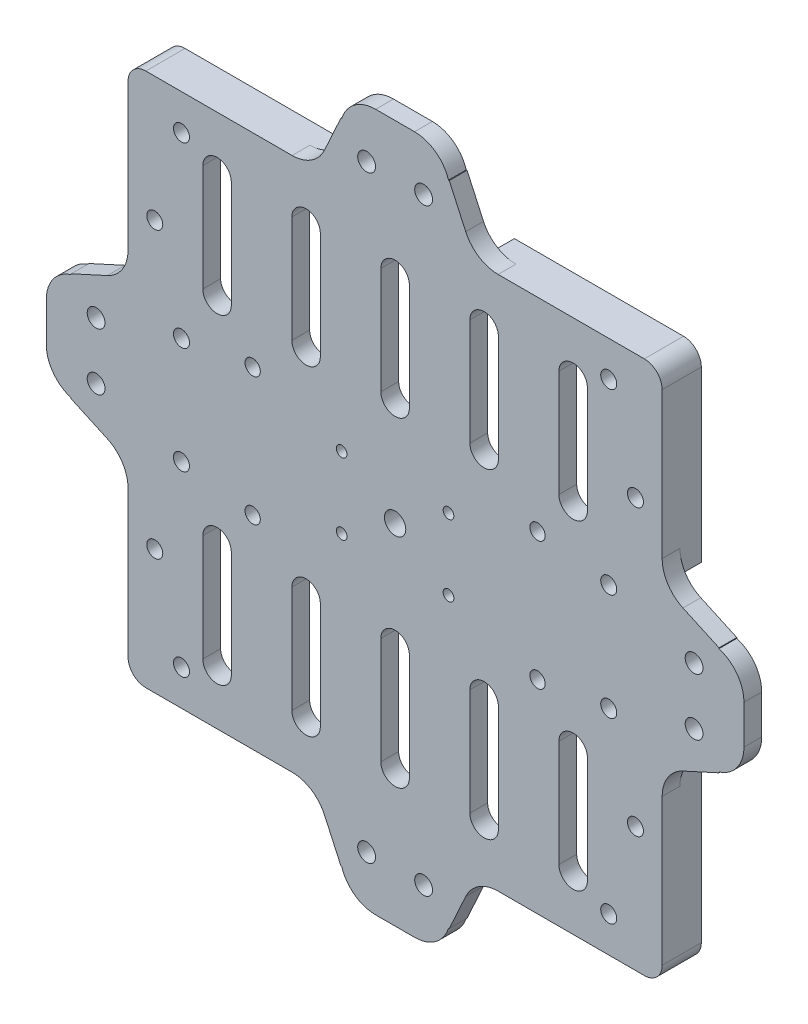
from build123d import *

# Parameters (mm, degrees)
SKETCH1_R           = 3
SKETCH1_R_2         = 2.5
SKETCH1_W           = 3
SKETCH1_H           = 12
SKETCH1_W_2         = 21
SKETCH1_H_2         = 3
SKETCH1_H_3         = 8
SKETCH1_W_3         = 12
SKETCH1_H_4         = 21
SKETCH1_W_4         = 8
BOSS_EXTRUDE1_DEPTH = 2.5
BOSS_EXTRUDE3_START = -8.5
BOSS_EXTRUDE3_DEPTH = 6
SKETCH6_R           = 2.15
SKETCH6_R_2         = 1.5
CUT_EXTRUDE3_DEPTH  = 5
BOSS_EXTRUDE4_START = -2.5
SKETCH7_W           = 7
SKETCH7_H           = 30
SKETCH7_W_2         = 30
SKETCH7_H_2         = 7
BOSS_EXTRUDE4_DEPTH = 5
FILLET1_R           = 10
FILLET3_R           = 5
SKETCH9_R           = 2.25
CUT_EXTRUDE4_DEPTH  = 5


with BuildPart() as part:
    # Sketch1 → Boss-Extrude1 (new, symmetric)
    # profile 1 of 31: a face of its own
    with BuildSketch(Plane.XY):
        Polygon((-72, -72), (-22.500000003, -72), (-10.500000004, -72), (-10.500000004, -64), (10.499999996, -64), (10.499999996, -72), (22.499999996, -72), (72, -72), (72, -22.500000003), (72, -10.500000004), (64, -10.500000004), (64, 10.499999996), (72, 10.499999996), (72, 22.499999996), (72, 72), (22.500000003, 72), (10.500000004, 72), (10.500000004, 64), (-10.499999996, 64), (-10.499999996, 72), (-22.499999996, 72), (-45, 72), (-72, 72), (-72, 45), (-72, 22.500000003), (-72, 10.500000004), (-64, 10.500000004), (-64, -10.499999996), (-72, -10.499999996), (-72, -22.499999996), align=None)
        Circle(SKETCH1_R, mode=Mode.SUBTRACT)
    # profile 2 of 31: a face of its own
    with BuildSketch(Plane.XY):
        Polygon((-90, 15.649247909), (-90, -15.649247896), (-74.99999999, -22.499999996), (-75, -10.499999996), (-75, 10.500000004), (-75, 22.500000003), align=None)
        with Locations((-83.969786151, -7.999999996)):
            Circle(SKETCH1_R_2, mode=Mode.SUBTRACT)
        with Locations((-83.969786151, 8.000000004)):
            Circle(SKETCH1_R_2, mode=Mode.SUBTRACT)
    # profile 3 of 31: a face of its own
    with BuildSketch(Plane.XY):
        Polygon((-72, 22.500000003), (-74.99999999, 22.500000003), (-75, 10.500000004), (-72, 10.500000004), align=None)
    # profile 4 of 31: a face of its own
    with BuildSketch(Plane.XY):
        Polygon((-75, 26.557364843), (-75, 22.500000003), (-72, 22.500000003), (-72, 45), (-75, 45), align=None)
    # profile 5 of 31: a face of its own
    with BuildSketch(Plane.XY):
        with Locations((-73.5, -16.499999996)):
            Rectangle(SKETCH1_W, SKETCH1_H)
    # profile 6 of 31: a face of its own
    with BuildSketch(Plane.XY):
        Polygon((-75, -75), (-22.500000003, -75), (-22.500000003, -72), (-72, -72), (-72, -22.499999996), (-74.99999999, -22.499999996), (-75, -24.91224327), align=None)
    # profile 7 of 31: a face of its own
    with BuildSketch(Plane.XY):
        Polygon((-22.500000003, -74.99999999), (-15.649247909, -90), (15.649247896, -90), (22.499999996, -74.99999999), (10.499999996, -75), (-10.500000004, -75), align=None)
        with Locations((-8.000000004, -83.969786151)):
            Circle(SKETCH1_R_2, mode=Mode.SUBTRACT)
        with Locations((7.999999996, -83.969786151)):
            Circle(SKETCH1_R_2, mode=Mode.SUBTRACT)
    # profile 8 of 31: a face of its own
    with BuildSketch(Plane.XY):
        Polygon((-22.500000003, -72), (-22.500000003, -74.99999999), (-10.500000004, -75), (-10.500000004, -72), align=None)
    # profile 9 of 31: a face of its own
    with BuildSketch(Plane.XY):
        with Locations((-4e-09, -73.5)):
            Rectangle(SKETCH1_W_2, SKETCH1_H_2)
    # profile 10 of 31: a face of its own
    with BuildSketch(Plane.XY):
        with Locations((-4e-09, -68)):
            Rectangle(SKETCH1_W_2, SKETCH1_H_3)
    # profile 11 of 31: a face of its own
    with BuildSketch(Plane.XY):
        with Locations((16.499999996, -73.5)):
            Rectangle(SKETCH1_W_3, SKETCH1_H_2)
    # profile 12 of 31: a face of its own
    with BuildSketch(Plane.XY):
        Polygon((22.499999996, -72), (22.499999996, -74.99999999), (75, -75), (75, -22.500000003), (72, -22.500000003), (72, -72), align=None)
    # profile 13 of 31: a face of its own
    with BuildSketch(Plane.XY):
        Polygon((15.649247896, -90), (-15.649247909, -90), (-15.206330276, -90.969786151), (15.206330267, -90.969786141), align=None)
    # profile 14 of 31: a face of its own
    with BuildSketch(Plane.XY):
        Polygon((72, -22.500000003), (74.99999999, -22.500000003), (75, -10.500000004), (72, -10.500000004), align=None)
    # profile 15 of 31: a face of its own
    with BuildSketch(Plane.XY):
        Polygon((74.99999999, -22.500000003), (90, -15.649247909), (90, 15.649247896), (74.99999999, 22.499999996), (75, 10.499999996), (75, -10.500000004), align=None)
        with Locations((83.969786151, -8.000000004)):
            Circle(SKETCH1_R_2, mode=Mode.SUBTRACT)
        with Locations((83.969786151, 7.999999996)):
            Circle(SKETCH1_R_2, mode=Mode.SUBTRACT)
    # profile 16 of 31: a face of its own
    with BuildSketch(Plane.XY):
        Polygon((90, 15.649247896), (90, -15.649247909), (90.969786151, -15.206330276), (90.969786141, 15.206330267), align=None)
    # profile 17 of 31: a face of its own
    with BuildSketch(Plane.XY):
        with Locations((73.5, -4e-09)):
            Rectangle(SKETCH1_W, SKETCH1_H_4)
    # profile 18 of 31: a face of its own
    with BuildSketch(Plane.XY):
        with Locations((68, -4e-09)):
            Rectangle(SKETCH1_W_4, SKETCH1_H_4)
    # profile 19 of 31: a face of its own
    with BuildSketch(Plane.XY):
        with Locations((73.5, 16.499999996)):
            Rectangle(SKETCH1_W, SKETCH1_H)
    # profile 20 of 31: a face of its own
    with BuildSketch(Plane.XY):
        Polygon((72, 22.499999996), (74.99999999, 22.499999996), (75, 75), (22.500000003, 75), (22.500000003, 72), (72, 72), align=None)
    # profile 21 of 31: a face of its own
    with BuildSketch(Plane.XY):
        Polygon((22.500000003, 72), (22.500000003, 74.99999999), (10.500000004, 75), (10.500000004, 72), align=None)
    # profile 22 of 31: a face of its own
    with BuildSketch(Plane.XY):
        Polygon((15.649247909, 90), (-15.649247896, 90), (-22.499999996, 74.99999999), (-10.499999996, 75), (10.500000004, 75), (22.500000003, 75), align=None)
        with Locations((-7.999999996, 83.969786151)):
            Circle(SKETCH1_R_2, mode=Mode.SUBTRACT)
        with Locations((8.000000004, 83.969786151)):
            Circle(SKETCH1_R_2, mode=Mode.SUBTRACT)
    # profile 23 of 31: a face of its own
    with BuildSketch(Plane.XY):
        with Locations((-16.499999996, 73.5)):
            Rectangle(SKETCH1_W_3, SKETCH1_H_2)
    # profile 24 of 31: a face of its own
    with BuildSketch(Plane.XY):
        with Locations((4e-09, 73.5)):
            Rectangle(SKETCH1_W_2, SKETCH1_H_2)
    # profile 25 of 31: a face of its own
    with BuildSketch(Plane.XY):
        Polygon((-15.206330267, 90.969786141), (-15.649247896, 90), (15.649247909, 90), (15.206330276, 90.969786151), align=None)
    # profile 26 of 31: a face of its own
    with BuildSketch(Plane.XY):
        Polygon((-22.499999996, 72), (-22.499999996, 74.99999999), (-45, 75), (-45, 72), align=None)
    # profile 27 of 31: a face of its own
    with BuildSketch(Plane.XY):
        with Locations((4e-09, 68)):
            Rectangle(SKETCH1_W_2, SKETCH1_H_3)
    # profile 28 of 31: a face of its own
    with BuildSketch(Plane.XY):
        Polygon((-75, 75), (-75, 45), (-72, 45), (-72, 72), (-45, 72), (-45, 75), align=None)
    # profile 29 of 31: a face of its own
    with BuildSketch(Plane.XY):
        with Locations((-68, 4e-09)):
            Rectangle(SKETCH1_W_4, SKETCH1_H_4)
    # profile 30 of 31: a face of its own
    with BuildSketch(Plane.XY):
        with Locations((-73.5, 4e-09)):
            Rectangle(SKETCH1_W, SKETCH1_H_4)
    # profile 31 of 31: a face of its own
    with BuildSketch(Plane.XY):
        Polygon((-90.969786141, -15.206330267), (-90, -15.649247896), (-90, 15.649247909), (-90.969786151, 15.206330276), align=None)
    extrude(amount=BOSS_EXTRUDE1_DEPTH, both=True)

    # Sketch1<4> → Boss-Extrude3 (add)
    with BuildSketch(Plane.XY.offset(BOSS_EXTRUDE3_START)):
        Polygon((-75, -75), (-22.500000003, -75), (-22.500000003, -72), (-72, -72), (-72, -22.499999996), (-74.99999999, -22.499999996), align=None)
        Polygon((22.499999996, -72), (22.499999996, -74.99999999), (75, -75), (75, -22.500000003), (72, -22.500000003), (72, -72), align=None)
        Polygon((-75, 45), (-74.99999999, 22.500000003), (-72, 22.500000003), (-72, 72), (-22.499999996, 72), (-22.499999996, 74.99999999), (-75, 75), align=None)
        Polygon((72, 22.499999996), (74.99999999, 22.499999996), (75, 75), (22.500000003, 75), (22.500000003, 72), (72, 72), align=None)
    extrude(amount=BOSS_EXTRUDE3_DEPTH)

    # Sketch6 → Cut-Extrude3 (cut, symmetric)
    with BuildSketch(Plane.XY):
        with Locations((40, 18)):
            Circle(SKETCH6_R)
        with Locations((-40, 18)):
            Circle(SKETCH6_R)
        with Locations((40, -18)):
            Circle(SKETCH6_R)
        with Locations((-40, -18)):
            Circle(SKETCH6_R)
        with Locations((-15, 10)):
            Circle(SKETCH6_R_2)
        with Locations((-15, -10)):
            Circle(SKETCH6_R_2)
        with Locations((15, -10)):
            Circle(SKETCH6_R_2)
        with Locations((15, 10)):
            Circle(SKETCH6_R_2)
        with BuildLine():
            Line((-46, 60), (-46, 30))
            ThreePointArc((-46, 30), (-50, 26), (-54, 30))
            Line((-54, 30), (-54, 60))
            ThreePointArc((-54, 60), (-50, 64), (-46, 60))
        make_face()
        with BuildLine():
            Line((-21, 60), (-21, 30))
            ThreePointArc((-21, 30), (-25, 26), (-29, 30))
            Line((-29, 30), (-29, 60))
            ThreePointArc((-29, 60), (-25, 64), (-21, 60))
        make_face()
        with BuildLine():
            Line((4, 60), (4, 30))
            ThreePointArc((4, 30), (0, 26), (-4, 30))
            Line((-4, 30), (-4, 60))
            ThreePointArc((-4, 60), (0, 64), (4, 60))
        make_face()
        with BuildLine():
            Line((29, 60), (29, 30))
            ThreePointArc((29, 30), (25, 26), (21, 30))
            Line((21, 30), (21, 60))
            ThreePointArc((21, 60), (25, 64), (29, 60))
        make_face()
        with BuildLine():
            Line((54, 60), (54, 30))
            ThreePointArc((54, 30), (50, 26), (46, 30))
            Line((46, 30), (46, 60))
            ThreePointArc((46, 60), (50, 64), (54, 60))
        make_face()
        with BuildLine():
            Line((-46, -60), (-46, -30))
            ThreePointArc((-46, -30), (-50, -26), (-54, -30))
            Line((-54, -30), (-54, -60))
            ThreePointArc((-54, -60), (-50, -64), (-46, -60))
        make_face()
        with BuildLine():
            Line((-21, -60), (-21, -30))
            ThreePointArc((-21, -30), (-25, -26), (-29, -30))
            Line((-29, -30), (-29, -60))
            ThreePointArc((-29, -60), (-25, -64), (-21, -60))
        make_face()
        with BuildLine():
            Line((4, -60), (4, -30))
            ThreePointArc((4, -30), (0, -26), (-4, -30))
            Line((-4, -30), (-4, -60))
            ThreePointArc((-4, -60), (0, -64), (4, -60))
        make_face()
        with BuildLine():
            Line((29, -60), (29, -30))
            ThreePointArc((29, -30), (25, -26), (21, -30))
            Line((21, -30), (21, -60))
            ThreePointArc((21, -60), (25, -64), (29, -60))
        make_face()
        with BuildLine():
            Line((54, -60), (54, -30))
            ThreePointArc((54, -30), (50, -26), (46, -30))
            Line((46, -30), (46, -60))
            ThreePointArc((46, -60), (50, -64), (54, -60))
        make_face()
    extrude(amount=CUT_EXTRUDE3_DEPTH, both=True, mode=Mode.SUBTRACT)

    # Sketch7 → Boss-Extrude4 (add)
    with BuildSketch(Plane.XY.offset(BOSS_EXTRUDE4_START)):
        with Locations((-94.469786151, 0)):
            Rectangle(SKETCH7_W, SKETCH7_H)
        with Locations((0, 94.469786151)):
            Rectangle(SKETCH7_W_2, SKETCH7_H_2)
        with Locations((94.469786151, 0)):
            Rectangle(SKETCH7_W, SKETCH7_H)
        with Locations((0, -94.469786151)):
            Rectangle(SKETCH7_W_2, SKETCH7_H_2)
    extrude(amount=BOSS_EXTRUDE4_DEPTH)

    # Fillet1
    # the kernel refuses this fillet: 10 mm, written as the material it adds along each edge
    with BuildSketch(Plane(origin=(22.499999996, -74.999999995, 2.5), x_dir=(-0.4154391795205238, -0.9096209584872779, 0), z_dir=(0, 0, -1)), Plane(origin=(74.999999995, 22.499999996, 2.5), x_dir=(0.9096209584872752, -0.41543917952052956, 0), z_dir=(0, 0, -1)), Plane(origin=(-74.999999995, -22.499999996, 2.5), x_dir=(-0.9096209584872703, 0.4154391795205402, 0), z_dir=(0, 0, -1)), Plane(origin=(-22.499999996, 74.999999995, 2.5), x_dir=(0.41543917952053416, 0.9096209584872732, 0), z_dir=(0, 0, -1))) as fillet1_piece_1:
        with BuildLine():
            CenterArc((FILLET1_R * 0.642642207755, -FILLET1_R), FILLET1_R, 89.999999981, 65.453023266)
            Line((-FILLET1_R * 0.266978750732, -FILLET1_R * 0.584560820479), (0, 0))
            Line((0, 0), (FILLET1_R * 0.642642208081, 0))
        make_face()
    extrude(amount=5)
    with BuildSketch(Plane(origin=(22.500000003, 74.999999995, 2.5), x_dir=(-0.4154391792289252, 0.9096209586204558, 0), z_dir=(0, 0, -1)), Plane(origin=(74.999999995, -22.500000003, 2.5), x_dir=(0.9096209586204533, 0.41543917922893076, 0), z_dir=(0, 0, -1)), Plane(origin=(-22.500000003, -74.999999995, 2.5), x_dir=(0.41543917922898005, -0.9096209586204307, 0), z_dir=(0, 0, -1)), Plane(origin=(-74.999999995, 22.500000003, 2.5), x_dir=(-0.9096209586204577, -0.4154391792289213, 0), z_dir=(0, 0, -1))) as fillet1_piece_2:
        with BuildLine():
            CenterArc((FILLET1_R * 0.642642207982, FILLET1_R), FILLET1_R, 204.546976734, 65.453023285)
            Line((-FILLET1_R * 0.266978750639, FILLET1_R * 0.584560820771), (0, 0))
            Line((0, 0), (FILLET1_R * 0.642642208307, 0))
        make_face()
    extrude(amount=5)
    # the kernel refuses this fillet: 10 mm, written as the material it takes off along each edge
    with BuildSketch(Plane(origin=(15, 97.969786151, -26.348480035), x_dir=(-1, 0, 0), z_dir=(0, 0, 1)), Plane(origin=(-97.969786151, 15, -26.348480035), x_dir=(0, -1, 0), z_dir=(0, 0, 1)), Plane(origin=(-15, -97.969786151, -26.348480035), x_dir=(1, 0, 0), z_dir=(0, 0, 1)), Plane(origin=(97.969786151, -15, -26.348480035), x_dir=(0, 1, 0), z_dir=(0, 0, 1))) as fillet1_2_piece_1:
        with BuildLine():
            CenterArc((9.539392014, 10), FILLET1_R, 197.457603124, 72.542396876)
            Line((0, 7), (0, 0))
            Line((0, 0), (9.539392014, 0))
        make_face()
    extrude(amount=52.696960071, mode=Mode.SUBTRACT)
    with BuildSketch(Plane(origin=(-15, 97.969786151, -26.348480035), x_dir=(0, -1, 0), z_dir=(0, 0, 1)), Plane(origin=(-97.969786151, -15, -26.348480035), x_dir=(1, 0, 0), z_dir=(0, 0, 1)), Plane(origin=(15, -97.969786151, -26.348480035), x_dir=(0, 1, 0), z_dir=(0, 0, 1)), Plane(origin=(97.969786151, 15, -26.348480035), x_dir=(-1, 0, 0), z_dir=(0, 0, 1))) as fillet1_2_piece_2:
        with BuildLine():
            CenterArc((10, 9.539392014), FILLET1_R, 180, 72.542396876)
            Line((0, 9.539392014), (0, 0))
            Line((0, 0), (7, 0))
        make_face()
    extrude(amount=52.696960071, mode=Mode.SUBTRACT)

    # Fillet3
    fillet3_edges = [part.edges().sort_by_distance(p)[0] for p in [
        (-75, 75, -5.5),
        (75, 75, -3),
        (75, -75, -3),
        (-75, -75, -5.5),
    ]]
    fillet(fillet3_edges, radius=FILLET3_R)

    # Sketch9 → Cut-Extrude4 (cut, symmetric)
    with BuildSketch(Plane.XY):
        with Locations((-60, 65)):
            Circle(SKETCH9_R)
        with Locations((-60, 15)):
            Circle(SKETCH9_R)
        with Locations((60, 15)):
            Circle(SKETCH9_R)
        with Locations((60, 65)):
            Circle(SKETCH9_R)
        with Locations((67.5, 40)):
            Circle(SKETCH9_R)
        with Locations((-67.5, 40)):
            Circle(SKETCH9_R)
        with Locations((-60, -15)):
            Circle(SKETCH9_R)
        with Locations((60, -15)):
            Circle(SKETCH9_R)
        with Locations((-60, -65)):
            Circle(SKETCH9_R)
        with Locations((-67.5, -40)):
            Circle(SKETCH9_R)
        with Locations((60, -65)):
            Circle(SKETCH9_R)
        with Locations((67.5, -40)):
            Circle(SKETCH9_R)
    extrude(amount=CUT_EXTRUDE4_DEPTH, both=True, mode=Mode.SUBTRACT)


solid = part.part
